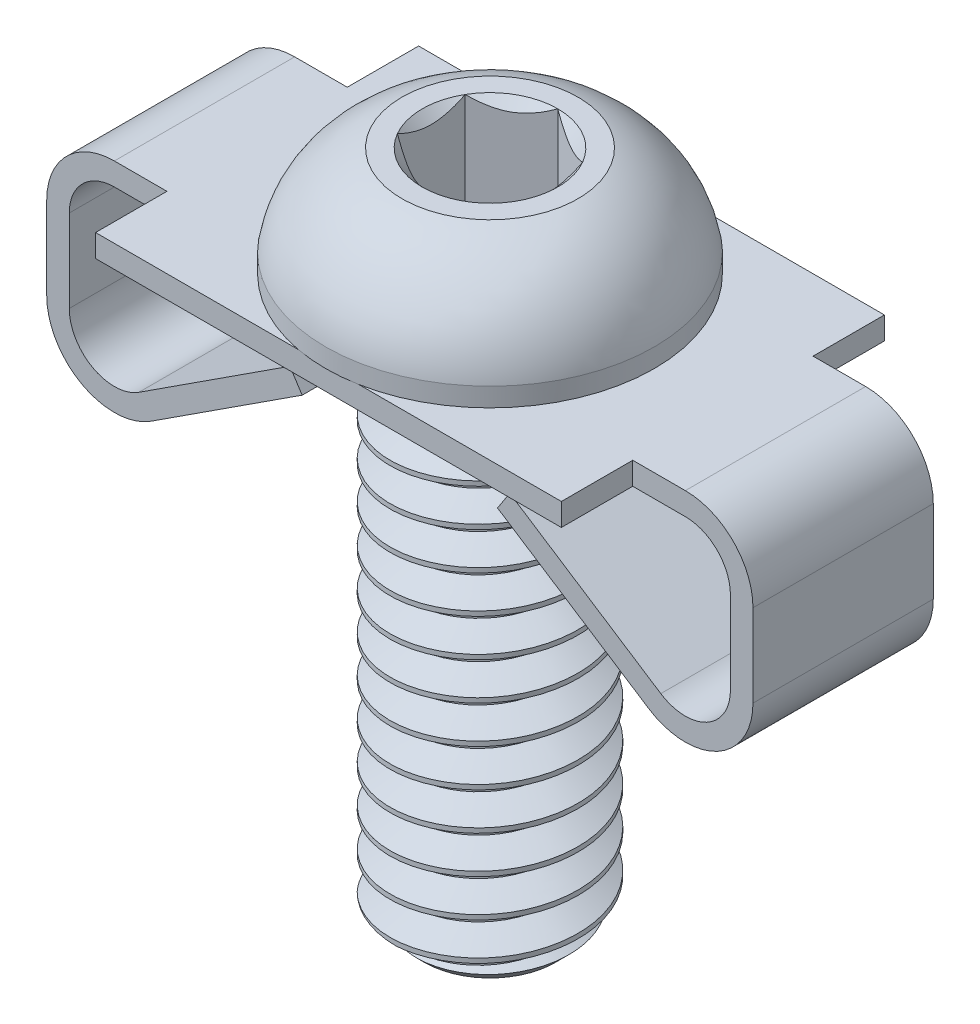
from build123d import *

# Parameters (mm, degrees)
SKETCH3_R          = 3.175
EXTRUDE1_DEPTH     = 19.05
CHAMFER1_SIZE      = 0.9525
CUT_SWEEP1_PITCH   = 1.27
EXTRUDE2_DEPTH     = 5.461
CUT_EXTRUDE2_DEPTH = 2.413
SKETCH7_R          = 5.55625
EXTRUDE4_DEPTH     = 3.683


with BuildPart() as part:
    # Sketch3 → Extrude1 (new body)
    with BuildSketch(Plane(origin=(0, 0, 0), x_dir=(1, 0, 0), z_dir=(0, 1, 0))):
        with Locations(Location((0, 0, 0), (0, 0, 270))):
            Circle(SKETCH3_R)
    extrude(amount=-EXTRUDE1_DEPTH)

    # Chamfer1
    chamfer1_edges = [part.edges().sort_by_distance(p)[0] for p in [
        (0, -19.05, -3.175),
    ]]
    chamfer(chamfer1_edges, length=CHAMFER1_SIZE)

    # Cut-Sweep1: arcs per turn and ends read off the stored shape
    # Cut-Sweep1: the profile of Sketch4 profile screwed along a right-hand helix through 19 turns, 6 arcs to a turn; built about Z, then put on its axis
    cut_sweep1_z = Axis((0, 0, 0), (0, 0, 1))
    cut_sweep1_corners = [(3.1753, 0, -1.270173205), (3.1753, 0, -0.158576795), (2.350110803, 0, -0.635), (2.350110803, 0, -0.79375)]
    with BuildLine(mode=Mode.PRIVATE) as cut_sweep1_profile:
        Line(cut_sweep1_corners[0], cut_sweep1_corners[1])
        Line(cut_sweep1_corners[1], cut_sweep1_corners[2])
        Line(cut_sweep1_corners[2], cut_sweep1_corners[3])
        Line(cut_sweep1_corners[3], cut_sweep1_corners[0])
    cut_sweep1_cap = Face(cut_sweep1_profile.wire())
    cut_sweep1_turn_angles = [0, 30, 60, 90, 120, 150, 180, 210, 240, 270, 300, 330, 360]
    cut_sweep1_turn_weights = [1, 0.8660254037844387, 1, 0.8660254037844387, 1, 0.8660254037844387, 1, 0.8660254037844387, 1, 0.8660254037844387, 1, 0.8660254037844387, 1]
    cut_sweep1_turn_rails = [Edge.make_bspline([Vector(p[0], p[1], 0).rotate(cut_sweep1_z, cut_sweep1_turn_angles[k]) / cut_sweep1_turn_weights[k] + Vector(0, 0, p[2] + CUT_SWEEP1_PITCH * cut_sweep1_turn_angles[k] / 360) for k in range(13)], [0, 0, 0, 1, 1, 2, 2, 3, 3, 4, 4, 5, 5, 6, 6, 6], 2, cut_sweep1_turn_weights) for p in cut_sweep1_corners]
    cut_sweep1_turn_sides = [Face.make_surface_from_curves(cut_sweep1_turn_rails[p[0]], cut_sweep1_turn_rails[p[1]]) for p in [(0, 1), (1, 2), (2, 3), (3, 0)]]
    cut_sweep1 = Plane(origin=(0, 0, 0), x_dir=(1, 0, 0), z_dir=(0, -1, 0)) * Solid(Shell([*[p.moved(Location((0, 0, CUT_SWEEP1_PITCH * i))) for i in range(19) for p in cut_sweep1_turn_sides], cut_sweep1_cap, cut_sweep1_cap.rotate(cut_sweep1_z, 6840).moved(Location((0, 0, CUT_SWEEP1_PITCH * 6840 / 360)))]))
    add(cut_sweep1, mode=Mode.SUBTRACT)



with BuildPart() as body_2:
    # Sketch5 → Extrude2 (new, symmetric)
    with BuildSketch(Plane.XY):
        with BuildLine():
            Line((-11.938, -2.286), (-11.938, -5.08))
            ThreePointArc((-11.938, -5.08), (-10.742922741, -7.088901086), (-8.407218221, -6.997371723))
            Line((-8.407218221, -6.997371723), (-3.302, -3.683))
            Line((-3.302, -3.683), (-3.71692726, -3.043876092))
            Line((-3.71692726, -3.043876092), (-8.822145481, -6.358247815))
            ThreePointArc((-8.822145481, -6.358247815), (-10.379281827, -6.419267391), (-11.176, -5.08))
            Line((-11.176, -5.08), (-11.176, -2.286))
            ThreePointArc((-11.176, -2.286), (-10.729630735, -1.208369265), (-9.652, -0.762))
            Line((-9.652, -0.762), (0, -0.762))
            Line((0, -0.762), (0, 0))
            Line((0, 0), (-9.652, 0))
            ThreePointArc((-9.652, 0), (-11.268446102, -0.669553898), (-11.938, -2.286))
        make_face()
    extrude(amount=EXTRUDE2_DEPTH, both=True)

    # Sketch6 → Cut-Extrude2 (cut)
    with BuildSketch(Plane.XY.offset(5.461)):
        Polygon((-11.938, 0), (-7.874, 0), (-7.874, -0.762), (-3.302, -0.762), (-3.302, -3.683), (-8.975026529, -7.366), (-11.938, -7.366), align=None)
    cut_extrude2 = extrude(amount=-CUT_EXTRUDE2_DEPTH, mode=Mode.SUBTRACT)

    # Mirror4: Cut-Extrude2 across plane
    add(cut_extrude2.mirror(Plane.XY), mode=Mode.SUBTRACT)

    # Mirror5: body 2 across plane


with BuildPart() as body_2_1:
    add(body_2.part)
    add(body_2.part.mirror(Plane(origin=(0, 0, 0), x_dir=(0, 0, 1), z_dir=(1, 0, 0))))


with BuildPart() as part_1:
    add(part.part)

    add(body_2_1.part)  # Extrude4 merges body 2
    # Sketch7 → Extrude4 (add)
    with BuildSketch(Plane(origin=(0, 0, 0), x_dir=(1, 0, 0), z_dir=(0, 1, 0))):
        with Locations(Location((0, 0, 0), (0, 0, 79.375668499))):
            Circle(SKETCH7_R)
        Polygon((0, 2.291358881), (-1.984375, 1.14567944), (-1.984375, -1.14567944), (0, -2.291358881), (1.984375, -1.14567944), (1.984375, 1.14567944), align=None, mode=Mode.SUBTRACT)
    extrude(amount=EXTRUDE4_DEPTH)

    # Sketch9 → Cut-Revolve1 (revolve, cut)
    with BuildSketch(Plane.XY, mode=Mode.PRIVATE) as cut_revolve1_sk:
        with BuildLine():
            Line((-5.55625, 0.635), (-5.55625, 3.683))
            Line((-5.55625, 3.683), (-2.9765625, 3.683))
            ThreePointArc((-2.9765625, 3.683), (-4.686975898, 2.514950874), (-5.55625, 0.635))
        make_face()
    revolve(cut_revolve1_sk.sketch.rotate(Axis((0, 0, 0), (0, -1, 0)), 100.624331501), axis=Axis((0, 0, 0), (0, -1, 0)), mode=Mode.SUBTRACT)

    # Cut-Extrude3 cone 1 section (through the dimple's axis) → Cut-Extrude3 (revolve, cut)
    with BuildSketch(Plane(origin=(0, 3.683, 0), x_dir=(0, 0, 1), z_dir=(1, 0, 0))):
        Polygon((0, 0), (2.291358881, 0), (0, 2.291358881), align=None)
    revolve(axis=Axis((0, 3.683, 0), (0, -1, 0)), mode=Mode.SUBTRACT)


solid = part_1.part
